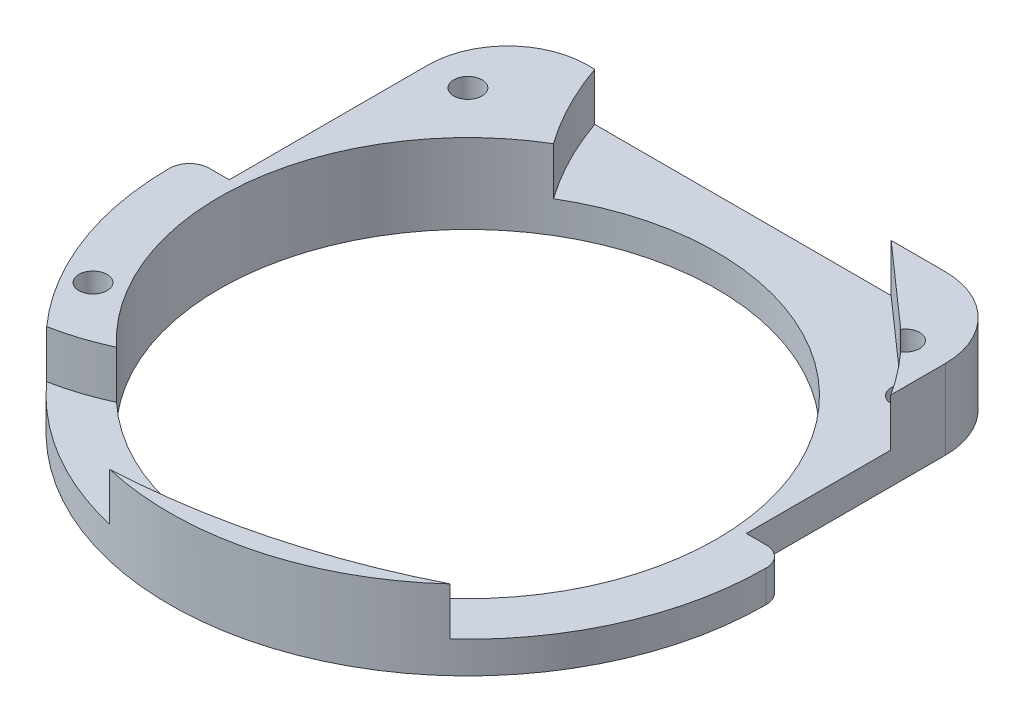
from build123d import *

# Parameters (mm, degrees)
SKETCH1_R           = 39.6875
BOSS_EXTRUDE1_DEPTH = 12.7
FILLET1_R           = 12.7
FILLET2_R           = 3.175
SKETCH2_R           = 2.25
CUT_EXTRUDE1_DEPTH  = 69.538830235
CUT_EXTRUDE2_DEPTH  = 7.62
SKETCH9_R           = 2.25
CUT_EXTRUDE3_DEPTH  = 69.538830235


with BuildPart() as part:
    # Sketch1 → Boss-Extrude1 (new body)
    with BuildSketch(Plane(origin=(0, 0, 0), x_dir=(1, 0, 0), z_dir=(0, 1, 0))):
        with BuildLine():
            Line((-47.625, 0), (-47.625, 3.175))
            Line((-47.625, 3.175), (-41.275, 3.175))
            Line((-41.275, 3.175), (-41.275, 47.625))
            Line((-41.275, 47.625), (41.275, 47.625))
            Line((41.275, 47.625), (41.275, 3.175))
            Line((41.275, 3.175), (47.625, 3.175))
            Line((47.625, 3.175), (47.625, 0))
            ThreePointArc((47.625, 0), (0, -47.625), (-47.625, 0))
        make_face()
        with Locations(Location((0, 0, 0), (0, 0, 270))):
            Circle(SKETCH1_R, mode=Mode.SUBTRACT)
    extrude(amount=BOSS_EXTRUDE1_DEPTH)

    # Fillet1
    fillet1_edges = [part.edges().sort_by_distance(p)[0] for p in [
        (-41.275, 6.35, -47.625),
        (41.275, 6.35, -47.625),
    ]]
    fillet(fillet1_edges, radius=FILLET1_R)

    # Fillet2
    fillet2_edges = [part.edges().sort_by_distance(p)[0] for p in [
        (47.625, 6.35, -3.175),
        (-47.625, 6.35, -3.175),
    ]]
    fillet(fillet2_edges, radius=FILLET2_R - 0.0001)  # a hair under: the kernel refuses the full size

    # Sketch2 → Cut-Extrude1 (cut, through all)
    with BuildSketch(Plane(origin=(0, 12.7, 0), x_dir=(1, 0, 0), z_dir=(0, 1, 0))):
        with Locations(Location((-34.925, 34.925, 0), (0, 0, 270))):
            Circle(SKETCH2_R)
        with Locations(Location((34.925, 34.925, 0), (0, 0, 270))):
            Circle(SKETCH2_R)
    extrude(amount=-CUT_EXTRUDE1_DEPTH, mode=Mode.SUBTRACT)

    # Sketch6 → Cut-Extrude2 (cut)
    with BuildSketch(Plane(origin=(0, 12.7, 0), x_dir=(1, 0, 0), z_dir=(0, 1, 0))):
        with BuildLine():
            Line((-49.187681697, -31.694494567), (-48.884558606, -41.276047168))
            ThreePointArc((-48.884558606, -41.276047168), (-5.562483374, -46.004938144), (36.043462017, -33.039217165))
            ThreePointArc((36.043462017, -33.039217165), (48.826767021, 2.582217505), (32.357577485, 36.656625654))
            Line((32.357577485, 36.656625654), (-25.491069939, 87.720848233))
            ThreePointArc((-25.491069939, 87.720848233), (-29.666518146, 56.664530057), (-15.884572215, 28.522262332))
            ThreePointArc((-15.884572215, 28.522262332), (-10.696498958, -13.664606553), (-49.187681697, -31.694494567))
        make_face()
    extrude(amount=-CUT_EXTRUDE2_DEPTH, mode=Mode.SUBTRACT)

    # Sketch9 → Cut-Extrude3 (cut, through all)
    with BuildSketch(Plane(origin=(0, 12.7, 0), x_dir=(1, 0, 0), z_dir=(0, 1, 0))):
        with Locations(Location((-37.944903067, -21.9075, 0), (0, 0, 270))):
            Circle(SKETCH9_R)
    extrude(amount=-CUT_EXTRUDE3_DEPTH, mode=Mode.SUBTRACT)


solid = part.part
